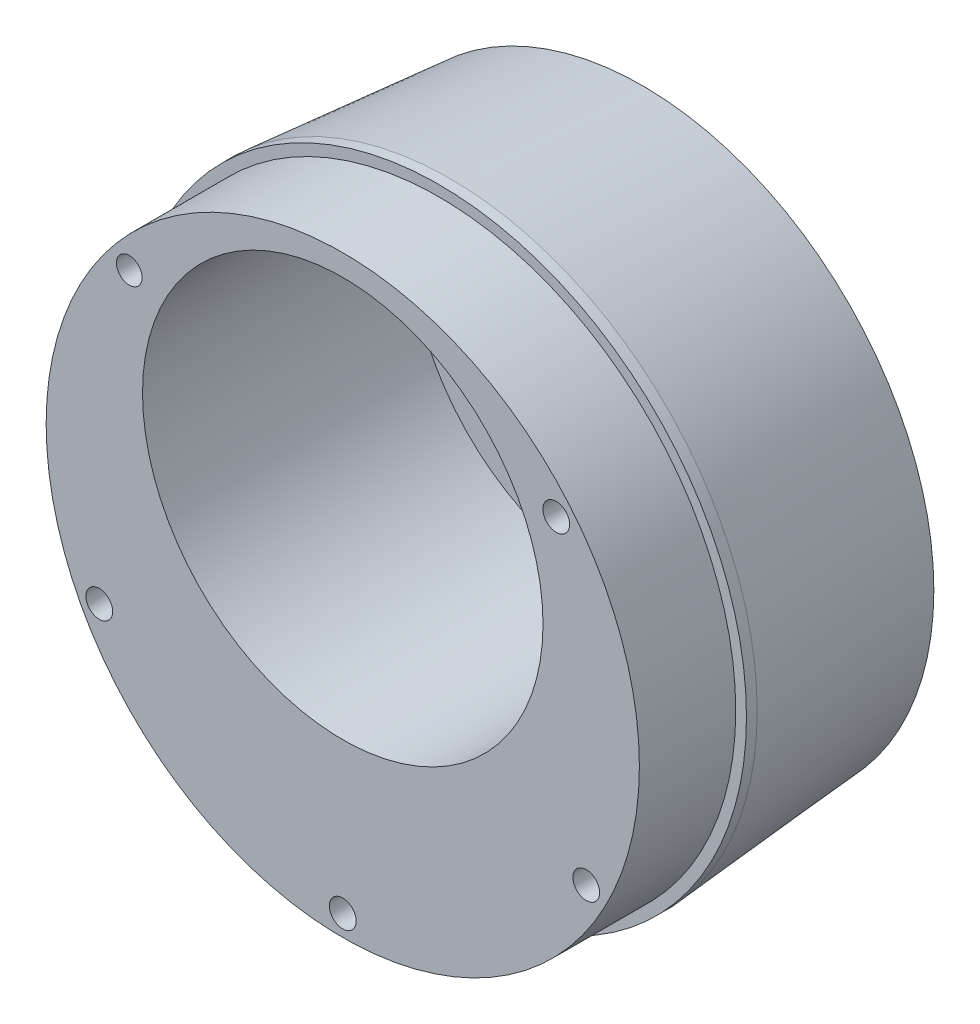
from build123d import *

# Parameters (mm, degrees)
SKETCH1_R              = 28.7
SKETCH1_R_2            = 6.15
SKETCH1_R_3            = 1.65
EXTRUDE_510_DEPTH      = 28
SKETCH2_R              = 18.7
CUT_EXTRUDE_689_DEPTH  = 25
CUT_EXTRUDE_START      = -9
SKETCH4_R              = 28.7
SKETCH4_R_2            = 27.7
CUT_EXTRUDE_844_DEPTH  = 9
SKETCH5_R              = 1.25
SKETCH5_R_2            = 1.2
CUT_EXTRUDE_1374_DEPTH = 10
SKETCH_1_R             = 3
CUT_EXTRUDE_1690_DEPTH = 0.5
CHAMFER_1743_SIZE      = 1.5
CHAMFER_1_SIZE         = 1.5
CHAMFER_1_SIZE2        = 18


with BuildPart() as part:
    # Sketch1 → Extrude 510 (new body)
    with BuildSketch(Plane.XY):
        Circle(SKETCH1_R)
        Circle(SKETCH1_R_2, mode=Mode.SUBTRACT)
        with Locations((15.5, 7)):
            Circle(SKETCH1_R_3, mode=Mode.SUBTRACT)
        with Locations((7.75, -6.423393759)):
            Circle(SKETCH1_R_3, mode=Mode.SUBTRACT)
        with Locations((-7.75, -6.423393759)):
            Circle(SKETCH1_R_3, mode=Mode.SUBTRACT)
        with Locations((-15.5, 7)):
            Circle(SKETCH1_R_3, mode=Mode.SUBTRACT)
        with Locations((-7.75, 20.423393759)):
            Circle(SKETCH1_R_3, mode=Mode.SUBTRACT)
        with Locations((7.75, 20.423393759)):
            Circle(SKETCH1_R_3, mode=Mode.SUBTRACT)
    extrude(amount=EXTRUDE_510_DEPTH)

    # Sketch2 → Cut-Extrude 689 (cut)
    with BuildSketch(Plane.XY.offset(28)):
        with Locations((0, 7)):
            Circle(SKETCH2_R)
    extrude(amount=-CUT_EXTRUDE_689_DEPTH, mode=Mode.SUBTRACT)

    # Sketch4 → Cut-Extrude 844 (cut)
    with BuildSketch(Plane.XY.offset(28).offset(CUT_EXTRUDE_START)):
        Circle(SKETCH4_R)
        Circle(SKETCH4_R_2, mode=Mode.SUBTRACT)
    extrude(amount=CUT_EXTRUDE_844_DEPTH, mode=Mode.SUBTRACT)

    # Sketch5 → Cut-Extrude 1374 (cut)
    with BuildSketch(Plane.XY.offset(28)):
        with Locations((-22.74001983, -12.081142252)):
            Circle(SKETCH5_R)
        with Locations((0, -25.75)):
            Circle(SKETCH5_R)
        with Locations(Location((19.936884337, 16.296721846, 0), (0, 0, 180))):
            Circle(SKETCH5_R)
        with Locations(Location((22.74001983, -12.081142252, 0), (0, 0, 180))):
            Circle(SKETCH5_R)
        with Locations((-19.936884337, 16.296721846)):
            Circle(SKETCH5_R_2)
    extrude(amount=-CUT_EXTRUDE_1374_DEPTH, mode=Mode.SUBTRACT)

    # Эскиз1 → Cut-Extrude 1690 (cut)
    with BuildSketch(Plane(origin=(0, 0, 0), x_dir=(-1, 0, 0), z_dir=(0, 0, -1))):
        with Locations((-7.75, 20.423393759)):
            Circle(SKETCH_1_R)
        with Locations((7.75, 20.423393759)):
            Circle(SKETCH_1_R)
        with Locations((15.5, 7)):
            Circle(SKETCH_1_R)
        with Locations((7.75, -6.423393759)):
            Circle(SKETCH_1_R)
        with Locations((-7.75, -6.423393759)):
            Circle(SKETCH_1_R)
        with Locations((-15.5, 7)):
            Circle(SKETCH_1_R)
    extrude(amount=-CUT_EXTRUDE_1690_DEPTH, mode=Mode.SUBTRACT)

    # Chamfer 1743
    # the kernel refuses this chamfer: 1.5 mm, written as the material it takes off along each edge
    with BuildSketch(Plane(origin=(15.5, 7, 0.5), x_dir=(1, 0, 0), z_dir=(0, 1, 0))) as chamfer_1743_piece_1_section:
        Polygon((1.65 + CHAMFER_1743_SIZE, 0), (1.65, -CHAMFER_1743_SIZE), (1.65, 0), align=None)
    chamfer_1743_piece_1 = revolve(axis=Axis((15.5, 7, 0.5), (0, 0, -1)), mode=Mode.PRIVATE)
    chamfer_1743_piece_1 = chamfer_1743_piece_1 & Plane(origin=(15.5, 7, 1.328305934), x_dir=(-1, 0, 0), z_dir=(0, 0, -1)) * Cylinder(3, 13, mode=Mode.PRIVATE)
    add(chamfer_1743_piece_1, mode=Mode.SUBTRACT)
    with BuildSketch(Plane(origin=(7.75, -6.423393759, 0.5), x_dir=(1, 0, 0), z_dir=(0, 1, 0))) as chamfer_1743_piece_2_section:
        Polygon((1.65 + CHAMFER_1743_SIZE, 0), (1.65, -CHAMFER_1743_SIZE), (1.65, 0), align=None)
    chamfer_1743_piece_2 = revolve(axis=Axis((7.75, -6.423393759, 0.5), (0, 0, -1)), mode=Mode.PRIVATE)
    chamfer_1743_piece_2 = chamfer_1743_piece_2 & Plane(origin=(7.75, -6.423393759, 1.328305934), x_dir=(-1, 0, 0), z_dir=(0, 0, -1)) * Cylinder(3, 13, mode=Mode.PRIVATE)
    add(chamfer_1743_piece_2, mode=Mode.SUBTRACT)
    with BuildSketch(Plane(origin=(-7.75, -6.423393759, 0.5), x_dir=(1, 0, 0), z_dir=(0, 1, 0))) as chamfer_1743_piece_3_section:
        Polygon((1.65 + CHAMFER_1743_SIZE, 0), (1.65, -CHAMFER_1743_SIZE), (1.65, 0), align=None)
    chamfer_1743_piece_3 = revolve(axis=Axis((-7.75, -6.423393759, 0.5), (0, 0, -1)), mode=Mode.PRIVATE)
    chamfer_1743_piece_3 = chamfer_1743_piece_3 & Plane(origin=(-7.75, -6.423393759, 1.328305934), x_dir=(-1, 0, 0), z_dir=(0, 0, -1)) * Cylinder(3, 13, mode=Mode.PRIVATE)
    add(chamfer_1743_piece_3, mode=Mode.SUBTRACT)
    with BuildSketch(Plane(origin=(-15.5, 7, 0.5), x_dir=(1, 0, 0), z_dir=(0, 1, 0))) as chamfer_1743_piece_4_section:
        Polygon((1.65 + CHAMFER_1743_SIZE, 0), (1.65, -CHAMFER_1743_SIZE), (1.65, 0), align=None)
    chamfer_1743_piece_4 = revolve(axis=Axis((-15.5, 7, 0.5), (0, 0, -1)), mode=Mode.PRIVATE)
    chamfer_1743_piece_4 = chamfer_1743_piece_4 & Plane(origin=(-15.5, 7, 1.328305934), x_dir=(-1, 0, 0), z_dir=(0, 0, -1)) * Cylinder(3, 13, mode=Mode.PRIVATE)
    add(chamfer_1743_piece_4, mode=Mode.SUBTRACT)
    with BuildSketch(Plane(origin=(-7.75, 20.423393759, 0.5), x_dir=(1, 0, 0), z_dir=(0, 1, 0))) as chamfer_1743_piece_5_section:
        Polygon((1.65 + CHAMFER_1743_SIZE, 0), (1.65, -CHAMFER_1743_SIZE), (1.65, 0), align=None)
    chamfer_1743_piece_5 = revolve(axis=Axis((-7.75, 20.423393759, 0.5), (0, 0, -1)), mode=Mode.PRIVATE)
    chamfer_1743_piece_5 = chamfer_1743_piece_5 & Plane(origin=(-7.75, 20.423393759, 1.328305934), x_dir=(-1, 0, 0), z_dir=(0, 0, -1)) * Cylinder(3, 13, mode=Mode.PRIVATE)
    add(chamfer_1743_piece_5, mode=Mode.SUBTRACT)
    with BuildSketch(Plane(origin=(7.75, 20.423393759, 0.5), x_dir=(1, 0, 0), z_dir=(0, 1, 0))) as chamfer_1743_piece_6_section:
        Polygon((1.65 + CHAMFER_1743_SIZE, 0), (1.65, -CHAMFER_1743_SIZE), (1.65, 0), align=None)
    chamfer_1743_piece_6 = revolve(axis=Axis((7.75, 20.423393759, 0.5), (0, 0, -1)), mode=Mode.PRIVATE)
    chamfer_1743_piece_6 = chamfer_1743_piece_6 & Plane(origin=(7.75, 20.423393759, 1.328305934), x_dir=(-1, 0, 0), z_dir=(0, 0, -1)) * Cylinder(3, 13, mode=Mode.PRIVATE)
    add(chamfer_1743_piece_6, mode=Mode.SUBTRACT)

    # Фаска1
    chamfer_1_edges = [part.edges().sort_by_distance(p)[0] for p in [
        (-28.7, 0, 0),
    ]]
    chamfer_1_side = [part.faces().sort_by_distance(p)[0] for p in [
        (-27.888241415, 0, 0),
    ]]
    chamfer(chamfer_1_edges, length=CHAMFER_1_SIZE, length2=CHAMFER_1_SIZE2, reference=chamfer_1_side[0])


solid = part.part
